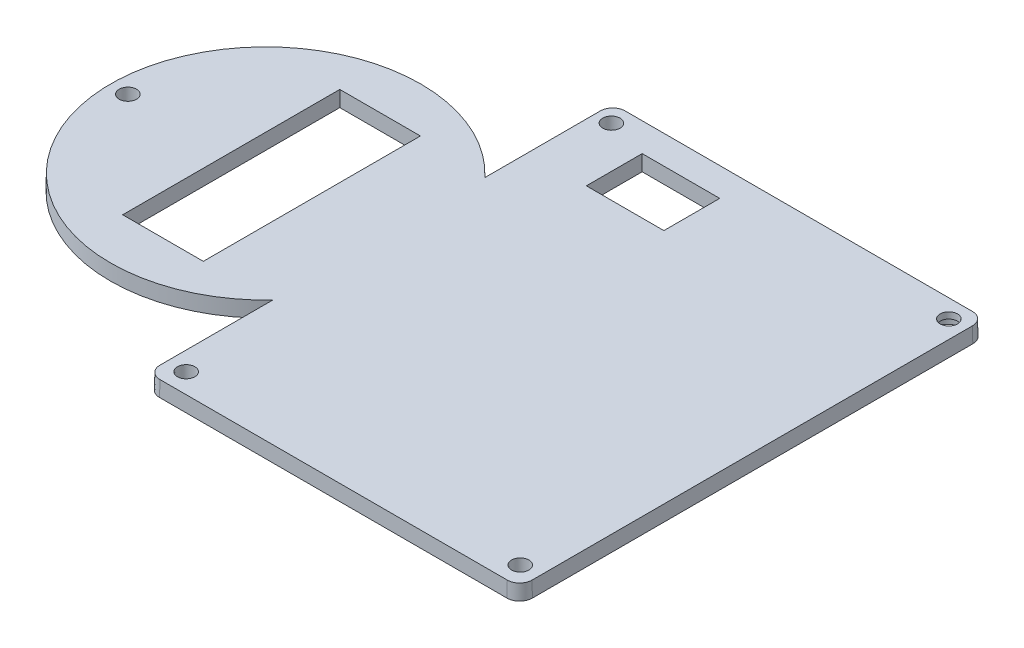
from build123d import *

# Parameters (mm, degrees)
SKETCH8_W                      = 120
SKETCH8_H                      = 150
BOSS_EXTRUDE3_DEPTH            = 5
SKETCH9_R                      = 50
BOSS_EXTRUDE4_DEPTH            = 5
BOSS_EXTRUDE8_OUTLINE_R        = 5.460321951
BOSS_EXTRUDE8_DEPTH            = 1
CUT_EXTRUDE9_OUTLINE_R         = 5
CUT_EXTRUDE9_DEPTH             = 3
F_2_0_221_DIAMETER_HOLE1_D     = 5.6134
F_2_0_221_DIAMETER_HOLE1_DEPTH = 8
F_2_0_221_DIAMETER_HOLE1_TIP   = 1.686435499
FILLET3_R                      = 4
SKETCH38_W                     = 26
SKETCH38_H                     = 70
CUT_EXTRUDE10_DEPTH            = 40
SKETCH39_W                     = 25
SKETCH39_H                     = 18
CUT_EXTRUDE11_DEPTH            = 40
DRAFT1_ANGLE                   = 1
DRAFT2_ANGLE                   = 1


# Read off the part's stored shape, not the designer's step: Boss-Extrude8, Cut-Extrude9, Draft5, Draft6
with BuildPart() as part:
    # Sketch8 → Boss-Extrude3 (new body)
    with BuildSketch(Plane(origin=(0, 0, 0), x_dir=(1, 0, 0), z_dir=(0, 1, 0))):
        with Locations((73.708855083, 72.164227744)):
            Rectangle(SKETCH8_W, SKETCH8_H)
    extrude(amount=BOSS_EXTRUDE3_DEPTH)

    # Sketch9 → Boss-Extrude4 (add)
    with BuildSketch(Plane(origin=(0, 0, 0), x_dir=(1, 0, 0), z_dir=(0, 1, 0))):
        with Locations((-22.779007595, 71.748458752)):
            Circle(SKETCH9_R)
    extrude(amount=BOSS_EXTRUDE4_DEPTH)

    # Boss-Extrude8 outline → Boss-Extrude8 (cut)
    with BuildSketch(Plane(origin=(0, 0, 0), x_dir=(1, 0, 0), z_dir=(0, 1, 0))):
        with Locations((19.708855083, 3.164227744)):
            Circle(BOSS_EXTRUDE8_OUTLINE_R)
    extrude(amount=BOSS_EXTRUDE8_DEPTH, mode=Mode.SUBTRACT)

    # Cut-Extrude9 outline → Cut-Extrude9 (cut)
    with BuildSketch(Plane(origin=(0, 0, 0), x_dir=(1, 0, 0), z_dir=(0, 1, 0))):
        with Locations((127.708855083, 141.164227744)):
            Circle(CUT_EXTRUDE9_OUTLINE_R)
    extrude(amount=CUT_EXTRUDE9_DEPTH, mode=Mode.SUBTRACT)

    # #2 (0.221) Diameter Hole1
    with Locations(Plane(origin=(0, 5, 0), x_dir=(1, 0, 0), z_dir=(0, 1, 0))):
        with Locations((18.917123201, 141.531370062), (127.969984407, 141.269223761), (127.602547564, 3.45328248), (19.774147178, 3.570575466), (-67.115618064, 71.668740496)):
            Hole(F_2_0_221_DIAMETER_HOLE1_D / 2, depth=F_2_0_221_DIAMETER_HOLE1_DEPTH)
            with Locations((0, 0, -(F_2_0_221_DIAMETER_HOLE1_DEPTH + F_2_0_221_DIAMETER_HOLE1_TIP / 2))):  # 118° drill point
                Cone(0, F_2_0_221_DIAMETER_HOLE1_D / 2, F_2_0_221_DIAMETER_HOLE1_TIP, mode=Mode.SUBTRACT)

    # Fillet3
    fillet3_edges = [part.edges().sort_by_distance(p)[0] for p in [
        (13.708855083, 2.5, -147.164227744),
        (133.708855083, 2.5, -147.164227744),
        (133.708855083, 2.5, 2.835772256),
        (13.708855083, 2.5, 2.835772256),
    ]]
    fillet(fillet3_edges, radius=FILLET3_R)

    # Sketch38 → Cut-Extrude10 (cut)
    with BuildSketch(Plane(origin=(0, 5, 0), x_dir=(1, 0, 0), z_dir=(0, 1, 0))):
        with Locations((-21.291144917, 72.164227744)):
            Rectangle(SKETCH38_W, SKETCH38_H)
    extrude(amount=-CUT_EXTRUDE10_DEPTH, mode=Mode.SUBTRACT)

    # Sketch39 → Cut-Extrude11 (cut)
    with BuildSketch(Plane(origin=(0, 5, 0), x_dir=(1, 0, 0), z_dir=(0, 1, 0))):
        with Locations((44.875898376, 128.991672485)):
            Rectangle(SKETCH39_W, SKETCH39_H)
    extrude(amount=-CUT_EXTRUDE11_DEPTH, mode=Mode.SUBTRACT)

    # Draft1
    draft1_faces = [part.faces().sort_by_distance(p)[0] for p in [
        (130.409247564, 2.5, -3.45328248),
        (132.537282207, 2.5, 1.664199381),
        (73.708855083, 2.5, 2.835772256),
        (44.875898376, 2.5, -137.991672485),
        (-21.291144917, 2.5, -107.164227744),
        (14.880427958, 2.5, 1.664199381),
        (57.375898376, 2.5, -128.991672485),
        (-34.291144917, 2.5, -72.164227744),
        (32.375898376, 2.5, -128.991672485),
        (133.708855083, 2.5, -72.164227744),
        (130.776684407, 4, -141.269223761),
        (132.537282207, 2.5, -145.992654868),
        (13.708855083, 2.5, -19.363684902),
        (22.580847178, 3, -3.570575466),
        (13.708855083, 2.5, -124.549001593),
        (-8.291144917, 2.5, -72.164227744),
        (-64.308918064, 2.5, -71.668740496),
        (-21.291144917, 2.5, -37.164227744),
        (-72.779007595, 2.5, -71.748458752),
        (21.723823201, 2.5, -141.531370062),
        (14.880427958, 2.5, -145.992654868),
        (44.875898376, 2.5, -119.991672485),
        (73.708855083, 2.5, -147.164227744),
    ]]
    draft(draft1_faces, Plane.ZX.offset(5), DRAFT1_ANGLE)

    # Draft2
    draft2_faces = [part.faces().sort_by_distance(p)[0] for p in [
        (14.248533132, 0.5, -3.164227744),
        (122.708855083, 1.5, -141.164227744),
    ]]
    draft(draft2_faces, Plane(origin=(0, 0, 0), x_dir=(0, 0, -1), z_dir=(0, -1, 0)), DRAFT2_ANGLE)

    # Draft5 outline → Draft5 (revolve)
    with BuildSketch(Plane(origin=(19.708855083, 0, -3.164227744), x_dir=(1, 0, 0), z_dir=(0, 0, 1))):
        Polygon((5.303226367, 1), (5.285771302, 0), (5.460321951, 0), (5.442866886, 1), align=None)
    revolve(axis=Axis((19.708855083, 0, -3.164227744), (0, 1, 0)))

    # Draft6 outline → Draft6 (revolve)
    with BuildSketch(Plane(origin=(127.708855083, 0, -141.164227744), x_dir=(1, 0, 0), z_dir=(0, 0, 1))):
        Polygon((4.877814546, 3), (4.825449351, 0), (5, 0), (4.947634805, 3), align=None)
    revolve(axis=Axis((127.708855083, 0, -141.164227744), (0, 1, 0)))


solid = part.part
